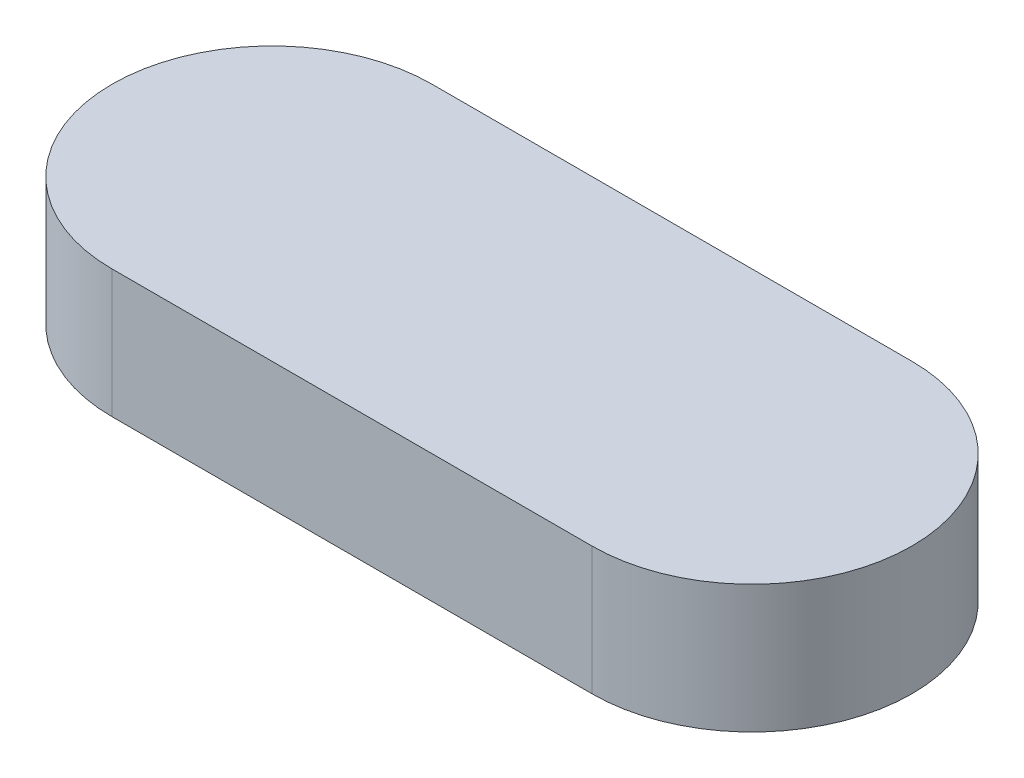
from build123d import *

# Parameters (mm, degrees)
BOSS_EXTRUDE1_DEPTH = 8
CUT_EXTRUDE1_DEPTH  = 1
SKETCH4_W           = 16
SKETCH4_H           = 7
CUT_EXTRUDE2_DEPTH  = 1
SHELL3_START        = 2
SHELL3_DEPTH        = 5.5
SHELL3_START_2      = 0.5
SHELL3_2_DEPTH      = 1.5
SHELL3_START_3      = 1.5
SHELL3_3_OUTLINE_W  = 17
SHELL3_3_OUTLINE_H  = 8
SHELL3_3_DEPTH      = 0.5


# Read off the part's stored shape, not the designer's step: Shell3
with BuildPart() as part:
    # Sketch2 → Boss-Extrude1 (new body)
    with BuildSketch(Plane(origin=(0, 0, 0), x_dir=(1, 0, 0), z_dir=(0, 1, 0))):
        with BuildLine():
            Line((-15, -10), (15, -10))
            ThreePointArc((15, -10), (25, 0), (15, 10))
            Line((15, 10), (-15, 10))
            ThreePointArc((-15, 10), (-25, 0), (-15, -10))
        make_face()
    extrude(amount=BOSS_EXTRUDE1_DEPTH)

    # Sketch3 → Cut-Extrude1 (cut)
    with BuildSketch(Plane.XZ):
        with BuildLine():
            Line((-5, 5), (5, 5))
            ThreePointArc((5, 5), (10, 0), (5, -5))
            Line((5, -5), (-5, -5))
            ThreePointArc((-5, -5), (-10, 0), (-5, 5))
        make_face()
    extrude(amount=-CUT_EXTRUDE1_DEPTH, mode=Mode.SUBTRACT)

    # Sketch4 → Cut-Extrude2 (cut)
    with BuildSketch(Plane.XZ.offset(-1)):
        Rectangle(SKETCH4_W, SKETCH4_H)
    extrude(amount=-CUT_EXTRUDE2_DEPTH, mode=Mode.SUBTRACT)

    # Shell3 outline → Shell3 (cut)
    with BuildSketch(Plane(origin=(0, 0, 0), x_dir=(1, 0, 0), z_dir=(0, 1, 0)).offset(SHELL3_START)):
        with BuildLine():
            Line((15, 9.5), (15, 10))
            Line((15, 10), (-15, 10))
            Line((-15, 10), (-15, 9.5))
            ThreePointArc((-15, 9.5), (-24.5, 0), (-15, -9.5))
            Line((-15, -9.5), (15, -9.5))
            ThreePointArc((15, -9.5), (24.5, 0), (15, 9.5))
        make_face()
    extrude(amount=SHELL3_DEPTH, mode=Mode.SUBTRACT)

    # Shell3 2 outline → Shell3 2 (cut)
    with BuildSketch(Plane(origin=(0, 0, 0), x_dir=(1, 0, 0), z_dir=(0, 1, 0)).offset(SHELL3_START_2)):
        with BuildLine():
            Line((15, 9.5), (15, 10))
            Line((15, 10), (-15, 10))
            Line((-15, 10), (-15, 9.5))
            ThreePointArc((-15, 9.5), (-24.5, 0), (-15, -9.5))
            Line((-15, -9.5), (15, -9.5))
            ThreePointArc((15, -9.5), (24.5, 0), (15, 9.5))
        make_face()
        with BuildLine():
            Line((5, -5.5), (-5, -5.5))
            ThreePointArc((-5, -5.5), (-10.5, 0), (-5, 5.5))
            Line((-5, 5.5), (5, 5.5))
            ThreePointArc((5, 5.5), (10.5, 0), (5, -5.5))
        make_face(mode=Mode.SUBTRACT)
    extrude(amount=SHELL3_2_DEPTH, mode=Mode.SUBTRACT)

    # Shell3 3 outline → Shell3 3 (cut)
    with BuildSketch(Plane(origin=(0, 0, 0), x_dir=(1, 0, 0), z_dir=(0, 1, 0)).offset(SHELL3_START_3)):
        with BuildLine():
            ThreePointArc((-5, 5.5), (-10.5, 0), (-5, -5.5))
            Line((-5, -5.5), (5, -5.5))
            ThreePointArc((5, -5.5), (10.5, 0), (5, 5.5))
            Line((5, 5.5), (-5, 5.5))
        make_face()
        Rectangle(SHELL3_3_OUTLINE_W, SHELL3_3_OUTLINE_H, mode=Mode.SUBTRACT)
    extrude(amount=SHELL3_3_DEPTH, mode=Mode.SUBTRACT)


solid = part.part
